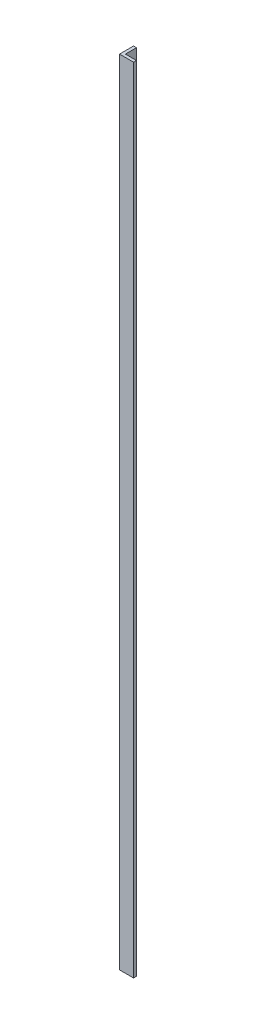
from build123d import *

# Parameters (mm, degrees)
BOSS_EXTRUDE1_DEPTH = 429.9


with BuildPart() as part:
    # Sketch1 → Boss-Extrude1 (new body)
    with BuildSketch(Plane(origin=(0, 0, 0), x_dir=(1, 0, 0), z_dir=(0, 1, 0))):
        Polygon((0, 0), (7.5875, 0), (7.5875, 1.5875), (1.5875, 1.5875), (1.5875, 7.5875), (0, 7.5875), align=None)
    extrude(amount=BOSS_EXTRUDE1_DEPTH)


solid = part.part
